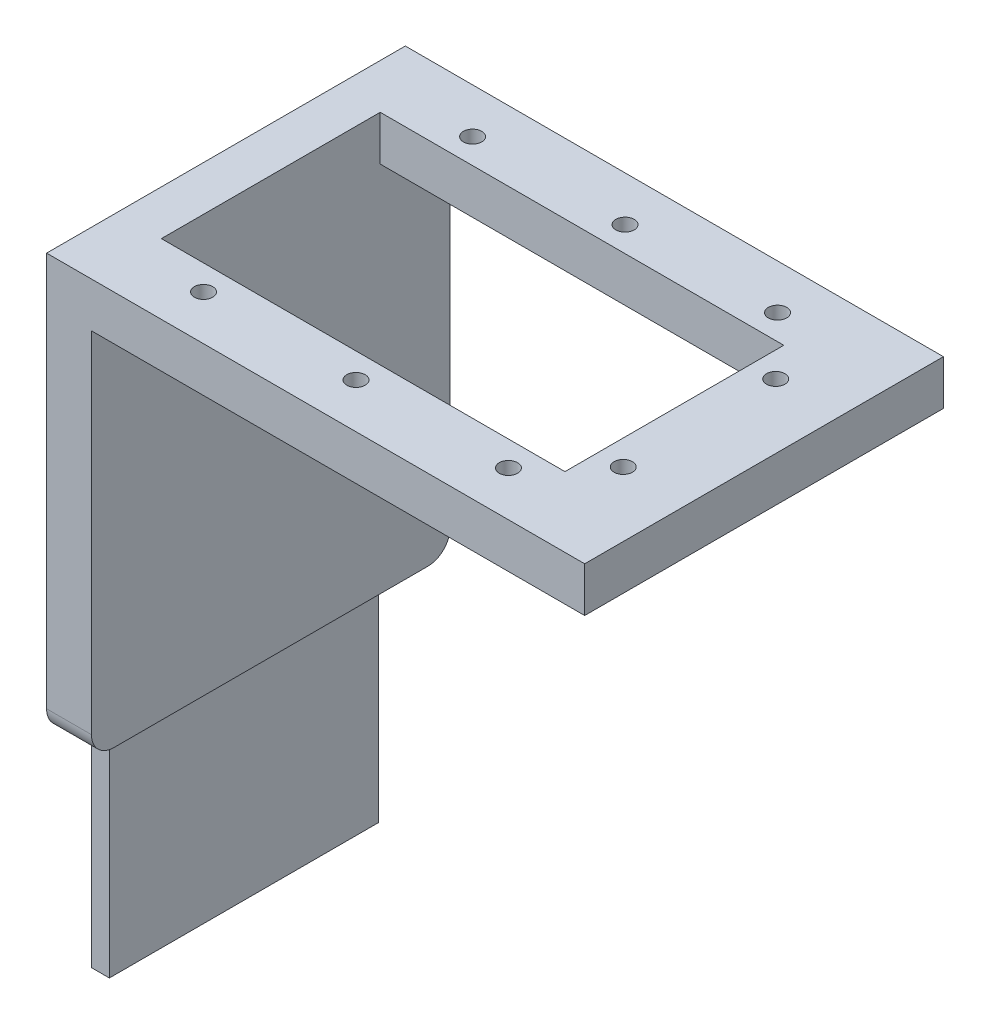
from build123d import *

# Parameters (mm, degrees)
SKETCH1_W           = 60
SKETCH1_H           = 40
SKETCH1_W_2         = 45
SKETCH1_H_2         = 24.4
BOSS_EXTRUDE1_DEPTH = 5
SKETCH6_W           = 5
SKETCH6_H           = 40
BOSS_EXTRUDE4_DEPTH = 41.5
SKETCH7_W           = 2
SKETCH7_H           = 30
BOSS_EXTRUDE5_DEPTH = 25
FILLET2_R           = 2.5
FILLET3_R           = 2.5
CUT_EXTRUDE1_REACH  = 100.093
SKETCH8_R           = 1.025


with BuildPart() as part:
    # Sketch1 → Boss-Extrude1 (new body)
    with BuildSketch(Plane(origin=(0, 0, 0), x_dir=(1, 0, 0), z_dir=(0, 1, 0))):
        with Locations((30, 20)):
            Rectangle(SKETCH1_W, SKETCH1_H)
        with Locations((27.5, 20)):
            Rectangle(SKETCH1_W_2, SKETCH1_H_2, mode=Mode.SUBTRACT)
    extrude(amount=BOSS_EXTRUDE1_DEPTH)

    # Sketch6 → Boss-Extrude4 (add)
    with BuildSketch(Plane.XZ):
        with Locations((2.5, -20)):
            Rectangle(SKETCH6_W, SKETCH6_H)
    extrude(amount=BOSS_EXTRUDE4_DEPTH)

    # Sketch7 → Boss-Extrude5 (add)
    with BuildSketch(Plane(origin=(0, -41.5, 0), x_dir=(-1, 0, 0), z_dir=(0, -1, 0))):
        with Locations((-1, 20)):
            Rectangle(SKETCH7_W, SKETCH7_H)
    extrude(amount=BOSS_EXTRUDE5_DEPTH)

    # Fillet2
    fillet2_edges = [part.edges().sort_by_distance(p)[0] for p in [
        (2, -41.5, -20),
    ]]
    fillet(fillet2_edges, radius=FILLET2_R)

    # Fillet3
    fillet3_edges = [part.edges().sort_by_distance(p)[0] for p in [
        (2.25, -41.5, -5),
        (2.25, -41.5, -35),
        (2.5, -41.5, 0),
        (2.5, -41.5, -40),
    ]]
    fillet(fillet3_edges, radius=FILLET3_R - 0.0001)  # a hair under: the kernel refuses the full size

    # Sketch8 → Cut-Extrude1 (cut, up to next)
    with BuildSketch(Plane(origin=(0, 0, 0), x_dir=(-1, 0, 0), z_dir=(0, -1, 0)), mode=Mode.PRIVATE) as cut_extrude1_sk1:
        with Locations(Location((-46.5, 5, 0), (0, 0, 90))):
            Circle(SKETCH8_R)
    cut_extrude1_tool1 = extrude(cut_extrude1_sk1.sketch, amount=-CUT_EXTRUDE1_REACH, mode=Mode.PRIVATE) & part.part
    # Sketch8 → Cut-Extrude1 (cut, up to next)
    with BuildSketch(Plane(origin=(0, 0, 0), x_dir=(-1, 0, 0), z_dir=(0, -1, 0)), mode=Mode.PRIVATE) as cut_extrude1_sk2:
        with Locations(Location((-29.5, 5, 0), (0, 0, 90))):
            Circle(SKETCH8_R)
    cut_extrude1_tool2 = extrude(cut_extrude1_sk2.sketch, amount=-CUT_EXTRUDE1_REACH, mode=Mode.PRIVATE) & part.part
    # Sketch8 → Cut-Extrude1 (cut, up to next)
    with BuildSketch(Plane(origin=(0, 0, 0), x_dir=(-1, 0, 0), z_dir=(0, -1, 0)), mode=Mode.PRIVATE) as cut_extrude1_sk3:
        with Locations(Location((-12.5, 5, 0), (0, 0, 90))):
            Circle(SKETCH8_R)
    cut_extrude1_tool3 = extrude(cut_extrude1_sk3.sketch, amount=-CUT_EXTRUDE1_REACH, mode=Mode.PRIVATE) & part.part
    # Sketch8 → Cut-Extrude1 (cut, up to next)
    with BuildSketch(Plane(origin=(0, 0, 0), x_dir=(-1, 0, 0), z_dir=(0, -1, 0)), mode=Mode.PRIVATE) as cut_extrude1_sk4:
        with Locations(Location((-52.8, 11.5, 0), (0, 0, 90))):
            Circle(SKETCH8_R)
    cut_extrude1_tool4 = extrude(cut_extrude1_sk4.sketch, amount=-CUT_EXTRUDE1_REACH, mode=Mode.PRIVATE) & part.part
    # Sketch8 → Cut-Extrude1 (cut, up to next)
    with BuildSketch(Plane(origin=(0, 0, 0), x_dir=(-1, 0, 0), z_dir=(0, -1, 0)), mode=Mode.PRIVATE) as cut_extrude1_sk5:
        with Locations(Location((-12.5, 35, 0), (0, 0, 90))):
            Circle(SKETCH8_R)
    cut_extrude1_tool5 = extrude(cut_extrude1_sk5.sketch, amount=-CUT_EXTRUDE1_REACH, mode=Mode.PRIVATE) & part.part
    # Sketch8 → Cut-Extrude1 (cut, up to next)
    with BuildSketch(Plane(origin=(0, 0, 0), x_dir=(-1, 0, 0), z_dir=(0, -1, 0)), mode=Mode.PRIVATE) as cut_extrude1_sk6:
        with Locations(Location((-29.5, 35, 0), (0, 0, 90))):
            Circle(SKETCH8_R)
    cut_extrude1_tool6 = extrude(cut_extrude1_sk6.sketch, amount=-CUT_EXTRUDE1_REACH, mode=Mode.PRIVATE) & part.part
    # Sketch8 → Cut-Extrude1 (cut, up to next)
    with BuildSketch(Plane(origin=(0, 0, 0), x_dir=(-1, 0, 0), z_dir=(0, -1, 0)), mode=Mode.PRIVATE) as cut_extrude1_sk7:
        with Locations(Location((-46.5, 35, 0), (0, 0, 90))):
            Circle(SKETCH8_R)
    cut_extrude1_tool7 = extrude(cut_extrude1_sk7.sketch, amount=-CUT_EXTRUDE1_REACH, mode=Mode.PRIVATE) & part.part
    # Sketch8 → Cut-Extrude1 (cut, up to next)
    with BuildSketch(Plane(origin=(0, 0, 0), x_dir=(-1, 0, 0), z_dir=(0, -1, 0)), mode=Mode.PRIVATE) as cut_extrude1_sk8:
        with Locations(Location((-52.8, 28.5, 0), (0, 0, 90))):
            Circle(SKETCH8_R)
    cut_extrude1_tool8 = extrude(cut_extrude1_sk8.sketch, amount=-CUT_EXTRUDE1_REACH, mode=Mode.PRIVATE) & part.part
    add(cut_extrude1_tool1.solids().sort_by_distance((46.5, 0, -5))[0], mode=Mode.SUBTRACT)
    add(cut_extrude1_tool2.solids().sort_by_distance((29.5, 0, -5))[0], mode=Mode.SUBTRACT)
    add(cut_extrude1_tool3.solids().sort_by_distance((12.5, 0, -5))[0], mode=Mode.SUBTRACT)
    add(cut_extrude1_tool4.solids().sort_by_distance((52.8, 0, -11.5))[0], mode=Mode.SUBTRACT)
    add(cut_extrude1_tool5.solids().sort_by_distance((12.5, 0, -35))[0], mode=Mode.SUBTRACT)
    add(cut_extrude1_tool6.solids().sort_by_distance((29.5, 0, -35))[0], mode=Mode.SUBTRACT)
    add(cut_extrude1_tool7.solids().sort_by_distance((46.5, 0, -35))[0], mode=Mode.SUBTRACT)
    add(cut_extrude1_tool8.solids().sort_by_distance((52.8, 0, -28.5))[0], mode=Mode.SUBTRACT)


solid = part.part
